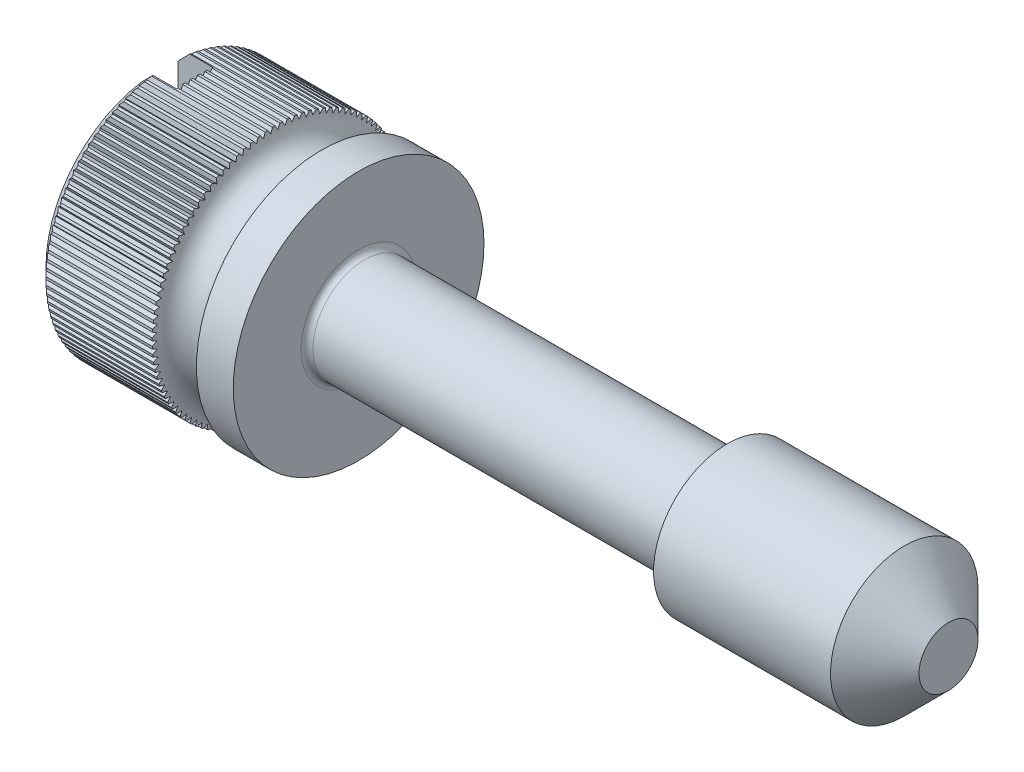
from build123d import *

# Parameters (mm, degrees)
SKETCH1_R               = 8.5
BASEHEAD_DEPTH          = 13.5
CHAMFER1_SIZE           = 0.8
CUT_EXTRUDE1_REACH      = 20.076
CIRCULARPATTERN1_COUNT  = 107
SKETCH4_R               = 3.5
BASEBODY_DEPTH          = 40
SKETCH5_R               = 5
BASEEND_DEPTH           = 15
CHAMFER2_SIZE           = 3
FILLET1_R               = 0.4
CUT_EXTRUDE2_DEPTH      = 67.884487863
CUT_EXTRUDE2_DEPTH_BACK = 67.884487863
SKETCH6_W               = 2.5
SKETCH6_H               = 7.4


with BuildPart() as part:
    # Sketch1 → BaseHead (new body)
    with BuildSketch(Plane(origin=(0, 0, 0), x_dir=(0, 0, -1), z_dir=(1, 0, 0))):
        Circle(SKETCH1_R)
    extrude(amount=BASEHEAD_DEPTH)

    # Sketch2 → Cut-Revolve1 (revolve, cut)
    with BuildSketch(Plane(origin=(12.663511575, 0, 1.163511575), x_dir=(0, 0, 1), z_dir=(0, 1, 0))):
        with BuildLine():
            Line((7.336488425, -1.663511575), (10.336488425, -1.663511575))
            Line((10.336488425, -1.663511575), (10.336488425, -4.663511575))
            Line((10.336488425, -4.663511575), (7.336488425, -4.663511575))
            ThreePointArc((7.336488425, -4.663511575), (5.836488425, -3.163511575), (7.336488425, -1.663511575))
        make_face()
    revolve(axis=Axis((17.65542619, 0, 0), (-1, 0, 0)), mode=Mode.SUBTRACT)

    # Chamfer1
    chamfer1_edges = [part.edges().sort_by_distance(p)[0] for p in [
        (0, 0, 8.5),
    ]]
    chamfer(chamfer1_edges, length=CHAMFER1_SIZE)

    # Sketch3 → Cut-Extrude1 (cut, up to next)
    with BuildSketch(Plane(origin=(0, 0, 0), x_dir=(0, 0, -1), z_dir=(1, 0, 0)), mode=Mode.PRIVATE) as cut_extrude1_sk1:
        Polygon((0, 8.211324865), (0.25, 8.644337567), (-0.25, 8.644337567), align=None)
    cut_extrude1_tool1 = extrude(cut_extrude1_sk1.sketch, amount=CUT_EXTRUDE1_REACH, mode=Mode.PRIVATE) & part.part
    cut_extrude1 = cut_extrude1_tool1.solids().sort_by_distance((0, 8.5, 0))[0]
    add(cut_extrude1, mode=Mode.SUBTRACT)

    # CircularPattern1: Cut-Extrude1 ×107 about axis
    circularpattern1_axis = Axis((17.65542619, 0, 0), (-1, 0, 0))
    for i in range(1, CIRCULARPATTERN1_COUNT):
        add(cut_extrude1.rotate(circularpattern1_axis, i * 360 / CIRCULARPATTERN1_COUNT), mode=Mode.SUBTRACT)

    # Sketch4 → BaseBody (add)
    with BuildSketch(Plane(origin=(13.5, 4.485233617, -2.150386847), x_dir=(0, 0, -1), z_dir=(1, 0, 0))):
        with Locations((-2.150386847, -4.485233617)):
            Circle(SKETCH4_R)
    extrude(amount=BASEBODY_DEPTH)

    # Sketch5 → BaseEnd (add)
    with BuildSketch(Plane(origin=(53.5, -0.857503988, -1.490033872), x_dir=(0, 0, -1), z_dir=(1, 0, 0))):
        with Locations((-1.490033872, 0.857503988)):
            Circle(SKETCH5_R)
    extrude(amount=-BASEEND_DEPTH)

    # Chamfer2
    chamfer2_edges = [part.edges().sort_by_distance(p)[0] for p in [
        (53.5, 0, 5),
    ]]
    chamfer(chamfer2_edges, length=CHAMFER2_SIZE)

    # Fillet1
    fillet1_edges = [part.edges().sort_by_distance(p)[0] for p in [
        (38.5, 0, 3.5),
        (13.5, 0, 3.5),
    ]]
    fillet(fillet1_edges, radius=FILLET1_R)

    # Sketch6 → Cut-Extrude2 (cut, two sides: drawn at the far end of the back side and taken through both)
    with BuildSketch(Plane(origin=(-10.162997409, 0, -10.162997409), x_dir=(0, 0, 1), z_dir=(0, 1, 0)).offset(-CUT_EXTRUDE2_DEPTH_BACK)):
        with Locations((10.162997409, 8.862997409)):
            Rectangle(SKETCH6_W, SKETCH6_H)
    extrude(amount=CUT_EXTRUDE2_DEPTH + CUT_EXTRUDE2_DEPTH_BACK, mode=Mode.SUBTRACT)


solid = part.part
